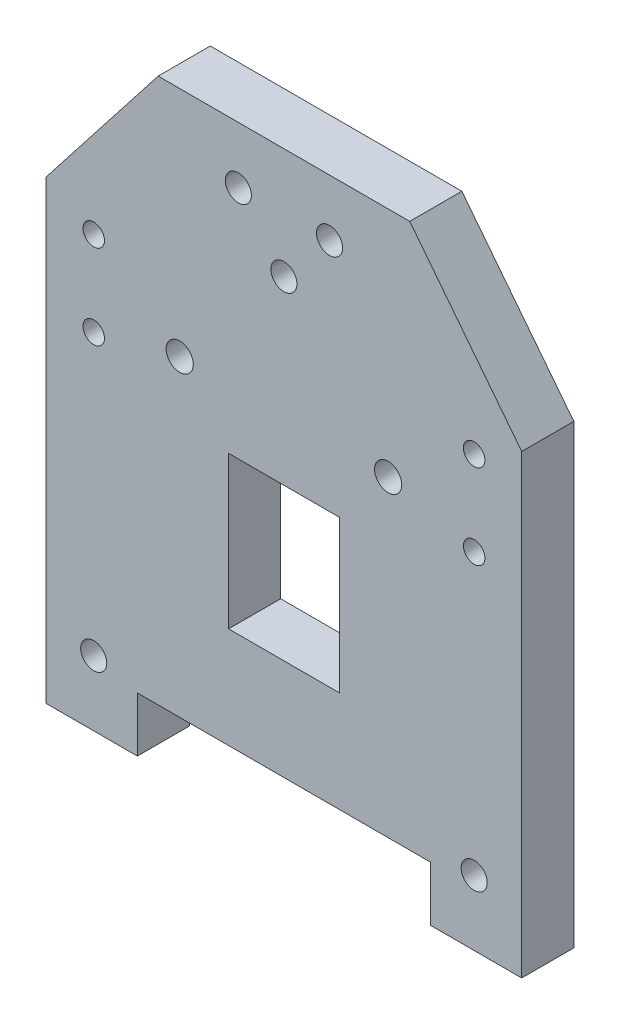
from build123d import *

# Parameters (mm, degrees)
ESBO_O1_R                = 2
ESBO_O1_R_2              = 2.086716092
ESBO_O1_R_3              = 2.086717953
RESSALTO_EXTRUS_O1_DEPTH = 8
ESBO_O4_R                = 1.65
CORTE_EXTRUS_O1_DEPTH    = 100.298791533


with BuildPart() as part:
    # Esboço1 → Ressalto-extrusão1 (new body)
    with BuildSketch(Plane.XY):
        Polygon((19.311716217, 92), (-19.311716217, 92), (-36.5, 70), (-36.5, 0), (-22.499999998, 0), (-22.499999998, 8.400000004), (22.499999998, 8.400000004), (22.499999998, 0), (36.5, 0), (36.5, 70), align=None)
        with Locations((0, 75)):
            Circle(ESBO_O1_R, mode=Mode.SUBTRACT)
        with Locations((-7, 83.3)):
            Circle(ESBO_O1_R, mode=Mode.SUBTRACT)
        with Locations((7, 83.3)):
            Circle(ESBO_O1_R, mode=Mode.SUBTRACT)
        with Locations((-29.2, 10)):
            Circle(ESBO_O1_R, mode=Mode.SUBTRACT)
        with Locations((29.2, 10)):
            Circle(ESBO_O1_R, mode=Mode.SUBTRACT)
        with Locations((-16, 56.354540575)):
            Circle(ESBO_O1_R_2, mode=Mode.SUBTRACT)
        with Locations((16, 56.354540575)):
            Circle(ESBO_O1_R_3, mode=Mode.SUBTRACT)
        Polygon((0, 47.257129716), (8.5, 47.257129716), (8.5, 23.917682695), (0, 23.917682695), (-8.5, 23.917682695), (-8.5, 47.257129716), align=None, mode=Mode.SUBTRACT)
    extrude(amount=RESSALTO_EXTRUS_O1_DEPTH)

    # Esboço4 → Corte-extrusão1 (cut, through all)
    with BuildSketch(Plane.XY.offset(8)):
        with Locations((-29.2, 66)):
            Circle(ESBO_O4_R)
        with Locations((-29.2, 53)):
            Circle(ESBO_O4_R)
        with Locations((29.2, 53)):
            Circle(ESBO_O4_R)
        with Locations((29.2, 66)):
            Circle(ESBO_O4_R)
    extrude(amount=-CORTE_EXTRUS_O1_DEPTH, mode=Mode.SUBTRACT)


solid = part.part
